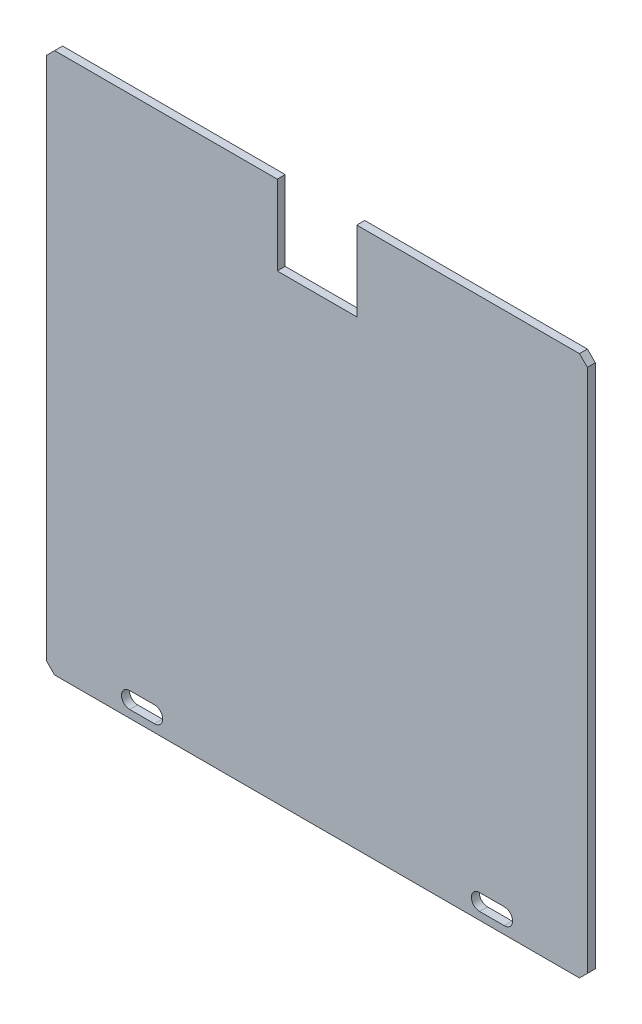
from build123d import *

# Parameters (mm, degrees)
SKETCH2_W           = 340
SKETCH2_H           = 340
BOSS_EXTRUDE1_DEPTH = 5
CHAMFER1_SIZE       = 5
CUT_EXTRUDE2_DEPTH  = 241.468293128
SKETCH5_W           = 50
SKETCH5_H           = 50
CUT_EXTRUDE3_DEPTH  = 241.468293128


with BuildPart() as part:
    # Sketch2 → Boss-Extrude1 (new body)
    with BuildSketch(Plane.XY):
        Rectangle(SKETCH2_W, SKETCH2_H)
    extrude(amount=BOSS_EXTRUDE1_DEPTH)

    # Chamfer1
    chamfer1_edges = [part.edges().sort_by_distance(p)[0] for p in [
        (170, 170, 2.5),
        (170, -170, 2.5),
        (-170, -170, 2.5),
        (-170, 170, 2.5),
    ]]
    chamfer(chamfer1_edges, length=CHAMFER1_SIZE)

    # Sketch4 → Cut-Extrude2 (cut, through all)
    with BuildSketch(Plane.XY.offset(5)):
        with BuildLine():
            Line((-7.8, 164.9), (7.8, 164.9))
            ThreePointArc((7.8, 164.9), (12.7, 160), (7.8, 155.1))
            Line((7.8, 155.1), (-7.8, 155.1))
            ThreePointArc((-7.8, 155.1), (-12.7, 160), (-7.8, 164.9))
        make_face()
        with BuildLine():
            Line((-117.8, -154.85), (-102.2, -154.85))
            ThreePointArc((-102.2, -154.85), (-97.05, -160), (-102.2, -165.15))
            Line((-102.2, -165.15), (-117.8, -165.15))
            ThreePointArc((-117.8, -165.15), (-122.95, -160), (-117.8, -154.85))
        make_face()
    cut_extrude2 = extrude(amount=-CUT_EXTRUDE2_DEPTH, mode=Mode.SUBTRACT)

    # Mirror1: Cut-Extrude2 across plane
    add(cut_extrude2.mirror(Plane(origin=(0, 0, 0), x_dir=(0, 0, 1), z_dir=(1, 0, 0))), mode=Mode.SUBTRACT)

    # Sketch5 → Cut-Extrude3 (cut, through all)
    with BuildSketch(Plane.XY.offset(5)):
        with Locations((0, 145)):
            Rectangle(SKETCH5_W, SKETCH5_H)
    extrude(amount=-CUT_EXTRUDE3_DEPTH, mode=Mode.SUBTRACT)


solid = part.part
